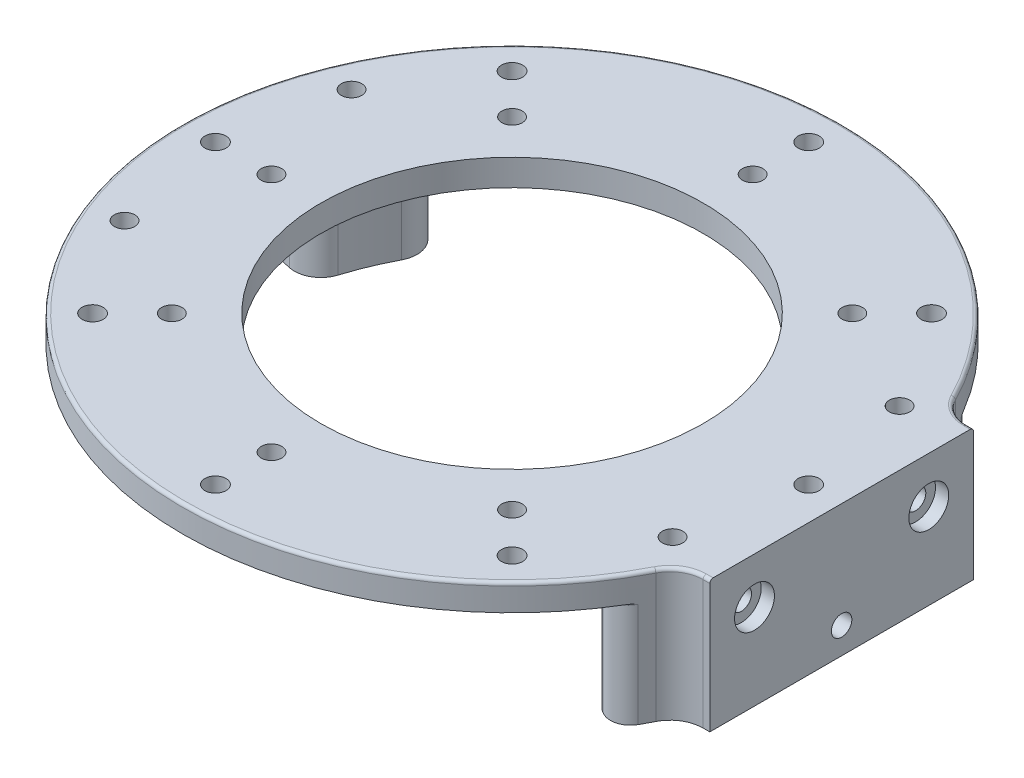
from build123d import *

# Parameters (mm, degrees)
SKETCH_1_R               = 50
EXTRUDE_1_DEPTH          = 20
CUT_EXTRUDE_1_REACH      = 83.24
SKETCH_2_R               = 29
CUT_EXTRUDE_2_REACH      = 83.24
SKETCH_3_R               = 1.6
PATTERN_CIRCULAR_1_COUNT = 8
CUT_EXTRUDE_3_REACH      = 83.24
SKETCH_4_R               = 1.55
PATTERN_CIRCULAR_2_COUNT = 8
SKETCH_5_R               = 40
CUT_EXTRUDE_4_DEPTH      = 36
CUT_EXTRUDE_6_DEPTH      = 16
PATTERN_CIRCULAR_3_COUNT = 8
EXTRUDE_5_REACH          = 115.578
EXTRUDE_5_END_RADIUS     = 50
SKETCH_10_W              = 40
SKETCH_10_H              = 40
CUT_EXTRUDE_START        = -16
CUT_EXTRUDE_8_DEPTH      = 32
SKETCH_15_R              = 1.55
CUT_EXTRUDE_10_DEPTH     = 82.240384046
SKETCH_36_R              = 3.5
CUT_EXTRUDE_23_DEPTH     = 5
FILLET_4_R               = 4
SKETCH_38_W              = 155.77544835
SKETCH_38_H              = 121.752290858
CUT_EXTRUDE_25_DEPTH     = 20
EXTRUDE_START            = 1.5
SKETCH_40_R              = 3
SKETCH_40_R_2            = 1.55
EXTRUDE_11_DEPTH         = 1.5
EXTRUDE_START_2          = -4
SKETCH_50_R              = 1.55
EXTRUDE_12_DEPTH         = 4
SKETCH_51_R              = 3.5
CUT_EXTRUDE_27_DEPTH     = 1
SKETCH_54_R              = 27.5
SKETCH_54_W              = 5.369059293
SKETCH_54_H              = 50.973462387
CUT_EXTRUDE_29_DEPTH     = 16
EXTRUDE_13_DEPTH         = 16
FILLET_9_R               = 5
FILLET_10_R              = 3
CHAMFER_1_SIZE           = 3
FILLET_11_R              = 0.5
FILLET_12_R              = 0.2
CUT_EXTRUDE_30_REACH     = 115.578
SKETCH_56_R              = 1.55
SKETCH_57_R              = 3.025
CUT_EXTRUDE_31_DEPTH     = 2


with BuildPart() as part:
    # 草图1 → 凸台-拉伸1 (new, symmetric)
    with BuildSketch(Plane(origin=(0, 0, 0), x_dir=(1, 0, 0), z_dir=(0, 1, 0))):
        with Locations(Location((0, 0, 0), (0, 0, 270))):
            Circle(SKETCH_1_R)
    extrude(amount=EXTRUDE_1_DEPTH, both=True)

    # 草图2 → 切除-拉伸1 (cut, up to next)
    with BuildSketch(Plane(origin=(0, 20, 0), x_dir=(1, 0, 0), z_dir=(0, 1, 0)), mode=Mode.PRIVATE) as cut_extrude_1_sk1:
        with Locations(Location((0, 0, 0), (0, 0, 270))):
            Circle(SKETCH_2_R)
    cut_extrude_1_tool1 = extrude(cut_extrude_1_sk1.sketch, amount=-CUT_EXTRUDE_1_REACH, mode=Mode.PRIVATE) & part.part
    add(cut_extrude_1_tool1.solids().sort_by_distance((0, 20, 0))[0], mode=Mode.SUBTRACT)

    # 草图3 → 切除-拉伸2 (cut, up to next)
    with BuildSketch(Plane(origin=(0, 20, 0), x_dir=(1, 0, 0), z_dir=(0, 1, 0)), mode=Mode.PRIVATE) as cut_extrude_2_sk1:
        with Locations(Location((0, 45, 0), (0, 0, 270))):
            Circle(SKETCH_3_R)
    cut_extrude_2_tool1 = extrude(cut_extrude_2_sk1.sketch, amount=-CUT_EXTRUDE_2_REACH, mode=Mode.PRIVATE) & part.part
    cut_extrude_2 = cut_extrude_2_tool1.solids().sort_by_distance((0, 20, -45))[0]
    add(cut_extrude_2, mode=Mode.SUBTRACT)

    # 阵列(圆周)1: 切除-拉伸2 ×8 about axis
    pattern_circular_1_axis = Axis((0, 0, 0), (0, 1, 0))
    for i in range(1, PATTERN_CIRCULAR_1_COUNT):
        add(cut_extrude_2.rotate(pattern_circular_1_axis, i * 360 / PATTERN_CIRCULAR_1_COUNT), mode=Mode.SUBTRACT)

    # 草图4 → 切除-拉伸3 (cut, up to next)
    with BuildSketch(Plane(origin=(0, 20, 0), x_dir=(1, 0, 0), z_dir=(0, 1, 0)), mode=Mode.PRIVATE) as cut_extrude_3_sk1:
        with Locations(Location((0, 36.5, 0), (0, 0, 270))):
            Circle(SKETCH_4_R)
    cut_extrude_3_tool1 = extrude(cut_extrude_3_sk1.sketch, amount=-CUT_EXTRUDE_3_REACH, mode=Mode.PRIVATE) & part.part
    cut_extrude_3 = cut_extrude_3_tool1.solids().sort_by_distance((0, 20, -36.5))[0]
    add(cut_extrude_3, mode=Mode.SUBTRACT)

    # 阵列(圆周)2: 切除-拉伸3 ×8 about axis
    pattern_circular_2_axis = Axis((0, 0, 0), (0, 1, 0))
    for i in range(1, PATTERN_CIRCULAR_2_COUNT):
        add(cut_extrude_3.rotate(pattern_circular_2_axis, i * 360 / PATTERN_CIRCULAR_2_COUNT), mode=Mode.SUBTRACT)

    # 草图5 → 切除-拉伸4 (cut)
    with BuildSketch(Plane.XZ.offset(20)):
        with Locations(Location((0, 0, 0), (0, 0, 270))):
            Circle(SKETCH_5_R)
    extrude(amount=-CUT_EXTRUDE_4_DEPTH, mode=Mode.SUBTRACT)

    # 草图6 → 切除-拉伸6 (cut, symmetric)
    with BuildSketch(Plane(origin=(0, 0, 0), x_dir=(1, 0, 0), z_dir=(0, 1, 0))):
        with BuildLine():
            Line((-39.125904029, -8.316467633), (-48.907380037, -10.395584541))
            ThreePointArc((-48.907380037, -10.395584541), (-50, 0), (-48.907380037, 10.395584541))
            Line((-48.907380037, 10.395584541), (-39.125904029, 8.316467633))
            ThreePointArc((-39.125904029, 8.316467633), (-40, 0), (-39.125904029, -8.316467633))
        make_face()
    cut_extrude_6 = extrude(amount=CUT_EXTRUDE_6_DEPTH, both=True, mode=Mode.SUBTRACT)

    # 阵列(圆周)3: 切除-拉伸6 ×8 about axis, 2 skipped
    pattern_circular_3_axis = Axis((0, 0, 0), (0, 1, 0))
    add([cut_extrude_6.rotate(pattern_circular_3_axis, i * 360 / PATTERN_CIRCULAR_3_COUNT) for i in range(1, PATTERN_CIRCULAR_3_COUNT) if i not in (2, 4)], mode=Mode.SUBTRACT)

    # 凸台-拉伸5: up to this cylinder (the profile starts outside it)
    extrude_5_end = Plane(origin=(0, 0, 0), z_dir=(0, -1, 0)) * Cylinder(EXTRUDE_5_END_RADIUS, 332.156, mode=Mode.PRIVATE)
    # 草图10 → 凸台-拉伸5 (add, up to the surface)
    with BuildSketch(Plane(origin=(50, 0, 0), x_dir=(0, 0, -1), z_dir=(1, 0, 0)), mode=Mode.PRIVATE) as extrude_5_sk1:
        Rectangle(SKETCH_10_W, SKETCH_10_H)
    extrude_5_tool1 = extrude(extrude_5_sk1.sketch, amount=-EXTRUDE_5_REACH, mode=Mode.PRIVATE) - extrude_5_end
    add(extrude_5_tool1.solids().sort_by_distance((50, 0, 0))[0])
    add(extrude_5_tool1.solids().sort_by_distance((50, 0, 0))[1])

    # 草图14 → 切除-拉伸8 (cut)
    with BuildSketch(Plane(origin=(0, 0, 0), x_dir=(1, 0, 0), z_dir=(0, 1, 0)).offset(CUT_EXTRUDE_START)):
        with BuildLine():
            Line((-27.231951751, 41.933528397), (-21.785561401, 33.546822718))
            ThreePointArc((-21.785561401, 33.546822718), (8.316467633, 39.125904029), (33.546822718, 21.785561401))
            Line((33.546822718, 21.785561401), (41.933528397, 27.231951751))
            ThreePointArc((41.933528397, 27.231951751), (10.395584541, 48.907380037), (-27.231951751, 41.933528397))
        make_face()
        with BuildLine():
            Line((-27.231951751, -41.933528397), (-21.785561401, -33.546822718))
            ThreePointArc((-21.785561401, -33.546822718), (8.316467633, -39.125904029), (33.546822718, -21.785561401))
            Line((33.546822718, -21.785561401), (41.933528397, -27.231951751))
            ThreePointArc((41.933528397, -27.231951751), (10.395584541, -48.907380037), (-27.231951751, -41.933528397))
        make_face()
    extrude(amount=CUT_EXTRUDE_8_DEPTH, mode=Mode.SUBTRACT)

    # 草图15 → 切除-拉伸10 (cut, through all)
    with BuildSketch(Plane.XZ.offset(20)):
        with Locations(Location((-41.574578963, 17.220754456, 0), (0, 0, 270))):
            Circle(SKETCH_15_R)
        with Locations(Location((-41.574578963, -17.220754456, 0), (0, 0, 90))):
            Circle(SKETCH_15_R)
        with Locations(Location((41.574578963, -17.220754456, 0), (0, 0, 270))):
            Circle(SKETCH_15_R)
        with Locations(Location((41.574578963, 17.220754456, 0), (0, 0, 90))):
            Circle(SKETCH_15_R)
    extrude(amount=-CUT_EXTRUDE_10_DEPTH, mode=Mode.SUBTRACT)

    # 草图36 → 切除-拉伸23 (cut)
    with BuildSketch(Plane.XZ.offset(20)):
        with Locations(Location((-41.574578963, 17.220754456, 0), (0, 0, 270))):
            Circle(SKETCH_36_R)
        with Locations(Location((-41.574578963, -17.220754456, 0), (0, 0, 270))):
            Circle(SKETCH_36_R)
        with Locations(Location((41.574578963, 17.220754456, 0), (0, 0, 270))):
            Circle(SKETCH_36_R)
        with Locations(Location((41.574578963, -17.220754456, 0), (0, 0, 270))):
            Circle(SKETCH_36_R)
    extrude(amount=-CUT_EXTRUDE_23_DEPTH, mode=Mode.SUBTRACT)

    # 圆角4
    fillet_4_edges = [part.edges().sort_by_distance(p)[0] for p in [
        (-39.125904029, 0, -8.316467633),
        (-39.125904029, 0, 8.316467633),
        (-48.907380037, 0, 10.395584541),
        (-48.907380037, 0, -10.395584541),
        (-33.546822718, 0, 21.785561401),
        (-41.933528397, 0, 27.231951751),
        (-33.546822718, 0, -21.785561401),
        (-41.933528397, 0, -27.231951751),
    ]]
    fillet(fillet_4_edges, radius=FILLET_4_R)

    # 草图38 → 切除-拉伸25 (cut)
    with BuildSketch(Plane.XZ.offset(20)):
        with Locations((20.616017654, 1.265324039)):
            Rectangle(SKETCH_38_W, SKETCH_38_H)
    extrude(amount=-CUT_EXTRUDE_25_DEPTH, mode=Mode.SUBTRACT)

    # 草图40 → 凸台-拉伸11 (add)
    # profile 1 of 4: a face of its own
    with BuildSketch(Plane.XZ.offset(EXTRUDE_START)):
        with Locations(Location((41.574578963, 17.220754456, 0), (0, 0, 270))):
            Circle(SKETCH_40_R)
        with Locations(Location((41.574578963, 17.220754456, 0), (0, 0, 270))):
            Circle(SKETCH_40_R_2, mode=Mode.SUBTRACT)
    # profile 2 of 4: a face of its own
    with BuildSketch(Plane.XZ.offset(EXTRUDE_START)):
        with Locations(Location((41.574578963, -17.220754456, 0), (0, 0, 270))):
            Circle(SKETCH_40_R)
        with Locations(Location((41.574578963, -17.220754456, 0), (0, 0, 270))):
            Circle(SKETCH_40_R_2, mode=Mode.SUBTRACT)
    # profile 3 of 4: a face of its own
    with BuildSketch(Plane.XZ.offset(EXTRUDE_START)):
        with Locations(Location((-41.574578963, 17.220754456, 0), (0, 0, 270))):
            Circle(SKETCH_40_R)
        with Locations(Location((-41.574578963, 17.220754456, 0), (0, 0, 270))):
            Circle(SKETCH_40_R_2, mode=Mode.SUBTRACT)
    # profile 4 of 4: a face of its own
    with BuildSketch(Plane.XZ.offset(EXTRUDE_START)):
        with Locations(Location((-41.574578963, -17.220754456, 0), (0, 0, 270))):
            Circle(SKETCH_40_R)
        with Locations(Location((-41.574578963, -17.220754456, 0), (0, 0, 270))):
            Circle(SKETCH_40_R_2, mode=Mode.SUBTRACT)
    extrude(amount=-EXTRUDE_11_DEPTH)

    # 草图50 → 凸台-拉伸12 (add)
    with BuildSketch(Plane.XZ.offset(-16).offset(EXTRUDE_START_2)):
        with Locations((36.5, 0)):
            Circle(SKETCH_50_R)
    extrude(amount=EXTRUDE_12_DEPTH)

    # 草图51 → 切除-拉伸27 (cut)
    with BuildSketch(Plane.XZ.offset(-16)):
        with Locations(Location((-45, 0, 0), (0, 0, 270))):
            Circle(SKETCH_51_R)
        with Locations(Location((-36.5, 0, 0), (0, 0, 270))):
            Circle(SKETCH_51_R)
        with Locations(Location((-31.819805153, 31.819805153, 0), (0, 0, 270))):
            Circle(SKETCH_51_R)
        with Locations(Location((-25.809397513, 25.809397513, 0), (0, 0, 270))):
            Circle(SKETCH_51_R)
        with Locations(Location((0, 45, 0), (0, 0, 270))):
            Circle(SKETCH_51_R)
        with Locations(Location((0, 36.5, 0), (0, 0, 270))):
            Circle(SKETCH_51_R)
        with Locations(Location((31.819805153, 31.819805153, 0), (0, 0, 270))):
            Circle(SKETCH_51_R)
        with Locations(Location((25.809397513, 25.809397513, 0), (0, 0, 270))):
            Circle(SKETCH_51_R)
        with Locations(Location((31.819805153, -31.819805153, 0), (0, 0, 270))):
            Circle(SKETCH_51_R)
        with Locations(Location((25.809397513, -25.809397513, 0), (0, 0, 270))):
            Circle(SKETCH_51_R)
        with Locations(Location((0, -45, 0), (0, 0, 270))):
            Circle(SKETCH_51_R)
        with Locations(Location((0, -36.5, 0), (0, 0, 270))):
            Circle(SKETCH_51_R)
        with Locations(Location((-31.819805153, -31.819805153, 0), (0, 0, 270))):
            Circle(SKETCH_51_R)
        with Locations(Location((-25.809397513, -25.809397513, 0), (0, 0, 270))):
            Circle(SKETCH_51_R)
    extrude(amount=-CUT_EXTRUDE_27_DEPTH, mode=Mode.SUBTRACT)

    # 草图54 → 切除-拉伸29 (cut)
    with BuildSketch(Plane.XZ):
        Circle(SKETCH_54_R)
        with Locations((35.055645912, -0.977974617)):
            Rectangle(SKETCH_54_W, SKETCH_54_H)
    extrude(amount=-CUT_EXTRUDE_29_DEPTH, mode=Mode.SUBTRACT)

    # 草图55 → 凸台-拉伸13 (add)
    with BuildSketch(Plane.XZ):
        with BuildLine():
            Line((37.740175558, 13.254401114), (37.740175558, -13.254401114))
            ThreePointArc((37.740175558, -13.254401114), (40, 0), (37.740175558, 13.254401114))
        make_face()
    extrude(amount=-EXTRUDE_13_DEPTH)

    # 圆角9
    fillet_9_edges = [part.edges().sort_by_distance(p)[0] for p in [
        (45.82575695, 10, 20),
        (45.82575695, 10, -20),
    ]]
    fillet(fillet_9_edges, radius=FILLET_9_R)

    # 圆角10
    fillet_10_edges = [part.edges().sort_by_distance(p)[0] for p in [
        (41.933528397, 8, 27.231951751),
        (41.933528397, 8, -27.231951751),
        (37.740175558, 8, 24.508756576),
        (37.740175558, 8, -24.508756576),
    ]]
    fillet(fillet_10_edges, radius=FILLET_10_R)

    # 倒角1
    # the kernel refuses this chamfer: 3 mm, written as the material it adds along each edge
    with BuildSketch(Plane(origin=(-36.74870307, 16, -23.864886814), x_dir=(-0.014975327704083106, -0.9996219169112968, 0.02305998245315948), z_dir=(-0.8386705679454244, 0, -0.5446390350150268)), Plane(origin=(-44.824354212, 16, -9.52771061), x_dir=(0.0057167141966235485, -0.9996219169112968, -0.02689502573671804), z_dir=(0.9781476007338056, 0, 0.20791169081775962)), Plane(origin=(-42.860280439, 16, 9.110233842), x_dir=(0.0057167141966234245, -0.9996219169112968, 0.026895025736717402), z_dir=(-0.9781476007338055, 0, 0.20791169081775998)), Plane(origin=(-38.432713607, 16, 24.958496044), x_dir=(-0.014975327704082058, -0.9996219169112968, -0.023059982453157858), z_dir=(0.8386705679454243, 0, -0.5446390350150269))) as chamfer_1_piece_1:
        Polygon((CHAMFER_1_SIZE * 0.999621916911, -CHAMFER_1_SIZE * 0.0274958766106), (-CHAMFER_1_SIZE * 0.0274958766106, -CHAMFER_1_SIZE * 0.999621916911), (0, 0), align=None)
    extrude(amount=2.007952349)
    with BuildSketch(Plane(origin=(0, 16, 0), x_dir=(-0.9551962199101347, 0, -0.2959732783029399), z_dir=(-0.2959732783029399, 0, 0.9551962199101347))) as chamfer_1_piece_2:
        Polygon((40, CHAMFER_1_SIZE), (40 - CHAMFER_1_SIZE, 0), (40, 0), align=None)
    revolve(axis=Axis((0, 16, 0), (0, -1, 0)), revolution_arc=10.568182859)
    with BuildSketch(Plane(origin=(0, 16, 0), x_dir=(-0.884710436600235, 0, 0.4661410123241909), z_dir=(0.4661410123241909, 0, 0.884710436600235))) as chamfer_1_piece_3:
        Polygon((40, CHAMFER_1_SIZE), (40 - CHAMFER_1_SIZE, 0), (40, 0), align=None)
    revolve(axis=Axis((0, 16, 0), (0, -1, 0)), revolution_arc=10.568182859)
    with BuildSketch(Plane(origin=(-40.611269747, 16, -21.603813772), x_dir=(-0.12969676692942406, 0, 0.991553704369085), z_dir=(0.991553704369085, 0, 0.12969676692942406))) as chamfer_1_piece_4_section:
        Polygon((4, CHAMFER_1_SIZE), (4 + CHAMFER_1_SIZE, 0), (4, 0), align=None)
    chamfer_1_piece_4 = revolve(axis=Axis((-40.611269747, 16, -21.603813772), (0, -1, 0)), revolution_arc=205.547930005, mode=Mode.PRIVATE)
    chamfer_1_piece_4 = chamfer_1_piece_4 & Plane(origin=(0, 14.736636688, 0), x_dir=(0, 0, 1), z_dir=(0, 1, 0)) * Cylinder(50, 29, mode=Mode.PRIVATE)
    chamfer_1_piece_4 = chamfer_1_piece_4 - Plane(origin=(-41.574578963, 14.736636688, -17.220754456), x_dir=(0, 0, 1), z_dir=(0, -1, 0)) * Cylinder(1.55, 29, mode=Mode.PRIVATE)
    add(chamfer_1_piece_4)
    with BuildSketch(Plane(origin=(-38.92725921, 16, -20.510204542), x_dir=(0.5446390350150275, 0, -0.8386705679454238), z_dir=(-0.8386705679454238, 0, -0.5446390350150275))) as chamfer_1_piece_5:
        Polygon((4, CHAMFER_1_SIZE), (4 + CHAMFER_1_SIZE, 0), (4, 0), align=None)
    revolve(axis=Axis((-38.92725921, 16, -20.510204542), (0, -1, 0)), revolution_arc=84.78409143)
    with BuildSketch(Plane(origin=(-42.028633676, 16, -13.022824245), x_dir=(-0.2079116908177579, 0, 0.978147600733806), z_dir=(-0.978147600733806, 0, -0.2079116908177579))) as chamfer_1_piece_6:
        Polygon((4, -CHAMFER_1_SIZE), (4 + CHAMFER_1_SIZE, 0), (4, 0), align=None)
    revolve(axis=Axis((-42.028633676, 16, -13.022824245), (0, 1, 0)), revolution_arc=84.78409143)
    with BuildSketch(Plane(origin=(-43.992707449, 16, -13.440301013), x_dir=(0.609424884876269, 0, -0.7928438116637768), z_dir=(0.7928438116637768, 0, 0.609424884876269))) as chamfer_1_piece_7_section:
        Polygon((4, -CHAMFER_1_SIZE), (4 + CHAMFER_1_SIZE, 0), (4, 0), align=None)
    chamfer_1_piece_7 = revolve(axis=Axis((-43.992707449, 16, -13.440301013), (0, 1, 0)), revolution_arc=205.547930005, mode=Mode.PRIVATE)
    chamfer_1_piece_7 = chamfer_1_piece_7 & Plane(origin=(0, 14.736635723, 0), x_dir=(0, 0, 1), z_dir=(0, 1, 0)) * Cylinder(50, 28, mode=Mode.PRIVATE)
    chamfer_1_piece_7 = chamfer_1_piece_7 - Plane(origin=(-41.574578963, 14.736635723, -17.220754456), x_dir=(0, 0, 1), z_dir=(0, -1, 0)) * Cylinder(1.55, 28, mode=Mode.PRIVATE)
    add(chamfer_1_piece_7)
    with BuildSketch(Plane(origin=(-42.028633676, 16, 13.022824245), x_dir=(-0.2079116908177578, 0, -0.9781476007338059), z_dir=(-0.9781476007338059, 0, 0.2079116908177578))) as chamfer_1_piece_8:
        Polygon((4, CHAMFER_1_SIZE), (4 + CHAMFER_1_SIZE, 0), (4, 0), align=None)
    revolve(axis=Axis((-42.028633676, 16, 13.022824245), (0, -1, 0)), revolution_arc=84.78409143)
    with BuildSketch(Plane(origin=(-43.992707449, 16, 13.440301013), x_dir=(0.6094248848762525, 0, 0.7928438116637894), z_dir=(0.7928438116637894, 0, -0.6094248848762525))) as chamfer_1_piece_9_section:
        Polygon((4, CHAMFER_1_SIZE), (4 + CHAMFER_1_SIZE, 0), (4, 0), align=None)
    chamfer_1_piece_9 = revolve(axis=Axis((-43.992707449, 16, 13.440301013), (0, -1, 0)), revolution_arc=205.547930005, mode=Mode.PRIVATE)
    chamfer_1_piece_9 = chamfer_1_piece_9 & Plane(origin=(0, 14.736635534, 0), x_dir=(0, 0, 1), z_dir=(0, 1, 0)) * Cylinder(50, 29, mode=Mode.PRIVATE)
    chamfer_1_piece_9 = chamfer_1_piece_9 - Plane(origin=(-41.574578963, 14.736635534, 17.220754456), x_dir=(0, 0, -1), z_dir=(0, -1, 0)) * Cylinder(1.55, 29, mode=Mode.PRIVATE)
    add(chamfer_1_piece_9)
    with BuildSketch(Plane(origin=(-38.92725921, 16, 20.510204542), x_dir=(0.5446390350150275, 0, 0.8386705679454238), z_dir=(-0.8386705679454238, 0, 0.5446390350150275))) as chamfer_1_piece_10:
        Polygon((4, -CHAMFER_1_SIZE), (4 + CHAMFER_1_SIZE, 0), (4, 0), align=None)
    revolve(axis=Axis((-38.92725921, 16, 20.510204542), (0, 1, 0)), revolution_arc=84.78409143)
    with BuildSketch(Plane(origin=(-40.611269747, 16, 21.603813772), x_dir=(-0.12969676692941334, 0, -0.9915537043690863), z_dir=(0.9915537043690863, 0, -0.12969676692941334))) as chamfer_1_piece_11_section:
        Polygon((4, -CHAMFER_1_SIZE), (4 + CHAMFER_1_SIZE, 0), (4, 0), align=None)
    chamfer_1_piece_11 = revolve(axis=Axis((-40.611269747, 16, 21.603813772), (0, 1, 0)), revolution_arc=205.547930005, mode=Mode.PRIVATE)
    chamfer_1_piece_11 = chamfer_1_piece_11 & Plane(origin=(0, 14.73663573, 0), x_dir=(0, 0, 1), z_dir=(0, 1, 0)) * Cylinder(50, 28, mode=Mode.PRIVATE)
    chamfer_1_piece_11 = chamfer_1_piece_11 - Plane(origin=(-41.574578963, 14.73663573, 17.220754456), x_dir=(0, 0, -1), z_dir=(0, -1, 0)) * Cylinder(1.55, 28, mode=Mode.PRIVATE)
    add(chamfer_1_piece_11)

    # 圆角11
    fillet_11_edges = [part.edges().sort_by_distance(p)[0] for p in [
        (49.494897428, 20, 20),
        (-50, 20, 0),
        (49.494897428, 20, -20),
        (46.378630016, 20, 20.735985673),
        (46.378630016, 20, -20.735985673),
    ]]
    fillet(fillet_11_edges, radius=FILLET_11_R)

    # 圆角12
    # the kernel refuses this fillet: 0.2 mm, written as the material it adds along each edge
    with BuildSketch(Plane(origin=(39.337136492, 16, -25.545835132), x_dir=(-0.5446390350150268, 0, -0.8386705679454243), z_dir=(-0.8386705679454243, 0, 0.5446390350150268)), Plane(origin=(39.106258452, 16, 25.395901181), x_dir=(-0.5446390350150268, 0, 0.8386705679454244), z_dir=(0.8386705679454244, 0, 0.5446390350150266))) as fillet_12_piece_1:
        with BuildLine():
            CenterArc((FILLET_12_R, FILLET_12_R), FILLET_12_R, 180, 90)
            Line((0, FILLET_12_R), (0, 0))
            Line((0, 0), (FILLET_12_R, 0))
        make_face()
    extrude(amount=0.275290499)
    with BuildSketch(Plane(origin=(37.740175558, 16, -22.879889477), x_dir=(-1, 0, 0), z_dir=(0, 0, 1))) as fillet_12_piece_2:
        with BuildLine():
            CenterArc((FILLET_12_R, FILLET_12_R), FILLET_12_R, 180, 90)
            Line((0, FILLET_12_R), (0, 0))
            Line((0, 0), (FILLET_12_R, 0))
        make_face()
    extrude(amount=45.759778954)
    with BuildSketch(Plane(origin=(40.971053597, 16, -23.029823429), x_dir=(0.9409582895141727, 0, -0.3385225212516329), z_dir=(0.3385225212516329, 0, 0.9409582895141727))) as fillet_12_piece_3_section:
        with BuildLine():
            CenterArc((3 + FILLET_12_R, -FILLET_12_R), FILLET_12_R, 90, 90)
            Line((3, -FILLET_12_R), (3, 0))
            Line((3, 0), (3 + FILLET_12_R, 0))
        make_face()
    fillet_12_piece_3 = revolve(axis=Axis((40.971053597, 16, -23.029823429), (0, 1, 0)), revolution_arc=103.213116375, mode=Mode.PRIVATE)
    fillet_12_piece_3 = fillet_12_piece_3 & Plane(origin=(0, 15.943722349, 0), x_dir=(0, 0, 1), z_dir=(0, 1, 0)) * Cylinder(50, 13, mode=Mode.PRIVATE)
    add(fillet_12_piece_3)
    with BuildSketch(Plane(origin=(40.740175558, 16, -22.879889477), x_dir=(-0.5446390350150258, 0, -0.8386705679454249), z_dir=(0.8386705679454249, 0, -0.5446390350150258))) as fillet_12_piece_4:
        with BuildLine():
            CenterArc((3 + FILLET_12_R, -FILLET_12_R), FILLET_12_R, 90, 90)
            Line((3, -FILLET_12_R), (3, 0))
            Line((3, 0), (3 + FILLET_12_R, 0))
        make_face()
    revolve(axis=Axis((40.740175558, 16, -22.879889477), (0, 1, 0)), revolution_arc=57)
    with BuildSketch(Plane(origin=(40.971053597, 16, 23.029823429), x_dir=(0.9409582895141702, 0, 0.33852252125164), z_dir=(0.33852252125164, 0, -0.9409582895141702))) as fillet_12_piece_5_section:
        with BuildLine():
            CenterArc((3 + FILLET_12_R, FILLET_12_R), FILLET_12_R, 180, 90)
            Line((3 + FILLET_12_R, 0), (3, 0))
            Line((3, 0), (3, FILLET_12_R))
        make_face()
    fillet_12_piece_5 = revolve(axis=Axis((40.971053597, 16, 23.029823429), (0, -1, 0)), revolution_arc=103.213116375, mode=Mode.PRIVATE)
    fillet_12_piece_5 = fillet_12_piece_5 & Plane(origin=(0, 15.943722811, 0), x_dir=(0, 0, 1), z_dir=(0, 1, 0)) * Cylinder(50, 13, mode=Mode.PRIVATE)
    add(fillet_12_piece_5)
    with BuildSketch(Plane(origin=(40.740175558, 16, 22.879889477), x_dir=(-0.5446390350150263, 0, 0.8386705679454246), z_dir=(0.8386705679454246, 0, 0.5446390350150263))) as fillet_12_piece_6:
        with BuildLine():
            CenterArc((3 + FILLET_12_R, FILLET_12_R), FILLET_12_R, 180, 90)
            Line((3, FILLET_12_R), (3, 0))
            Line((3, 0), (3 + FILLET_12_R, 0))
        make_face()
    revolve(axis=Axis((40.740175558, 16, 22.879889477), (0, -1, 0)), revolution_arc=57)

    # 切除-拉伸30: up to this face of the body (flat: up to its plane)
    cut_extrude_30_end = Plane(part.part.faces().sort_by_distance((37.740175558, 7.9, 0))[0])
    # 草图56 → 切除-拉伸30 (cut, up to the picked face)
    with BuildSketch(Plane(origin=(50, 0, 0), x_dir=(0, 0, -1), z_dir=(1, 0, 0)), mode=Mode.PRIVATE) as cut_extrude_30_sk1:
        with Locations((-13.22, 13)):
            Circle(SKETCH_56_R)
    cut_extrude_30_tool1 = split(extrude(cut_extrude_30_sk1.sketch, amount=-CUT_EXTRUDE_30_REACH, mode=Mode.PRIVATE), bisect_by=cut_extrude_30_end, keep=Keep.BOTH, mode=Mode.PRIVATE)
    # 草图56 → 切除-拉伸30 (cut, up to the picked face)
    with BuildSketch(Plane(origin=(50, 0, 0), x_dir=(0, 0, -1), z_dir=(1, 0, 0)), mode=Mode.PRIVATE) as cut_extrude_30_sk2:
        with Locations((13.22, 13)):
            Circle(SKETCH_56_R)
    cut_extrude_30_tool2 = split(extrude(cut_extrude_30_sk2.sketch, amount=-CUT_EXTRUDE_30_REACH, mode=Mode.PRIVATE), bisect_by=cut_extrude_30_end, keep=Keep.BOTH, mode=Mode.PRIVATE)
    # 草图56 → 切除-拉伸30 (cut, up to the picked face)
    with BuildSketch(Plane(origin=(50, 0, 0), x_dir=(0, 0, -1), z_dir=(1, 0, 0)), mode=Mode.PRIVATE) as cut_extrude_30_sk3:
        with Locations((0, 4)):
            Circle(SKETCH_56_R)
    cut_extrude_30_tool3 = split(extrude(cut_extrude_30_sk3.sketch, amount=-CUT_EXTRUDE_30_REACH, mode=Mode.PRIVATE), bisect_by=cut_extrude_30_end, keep=Keep.BOTH, mode=Mode.PRIVATE)
    add(cut_extrude_30_tool1.solids().sort_by(Axis((50, 13, 13.22), (-1, 0, 0)))[0], mode=Mode.SUBTRACT)
    add(cut_extrude_30_tool2.solids().sort_by(Axis((50, 13, -13.22), (-1, 0, 0)))[0], mode=Mode.SUBTRACT)
    add(cut_extrude_30_tool3.solids().sort_by(Axis((50, 4, 0), (-1, 0, 0)))[0], mode=Mode.SUBTRACT)

    # 草图57 → 切除-拉伸31 (cut)
    with BuildSketch(Plane(origin=(50, 0, 0), x_dir=(0, 0, -1), z_dir=(1, 0, 0))):
        with Locations((13.22, 13)):
            Circle(SKETCH_57_R)
        with Locations((-13.22, 13)):
            Circle(SKETCH_57_R)
    extrude(amount=-CUT_EXTRUDE_31_DEPTH, mode=Mode.SUBTRACT)


solid = part.part
